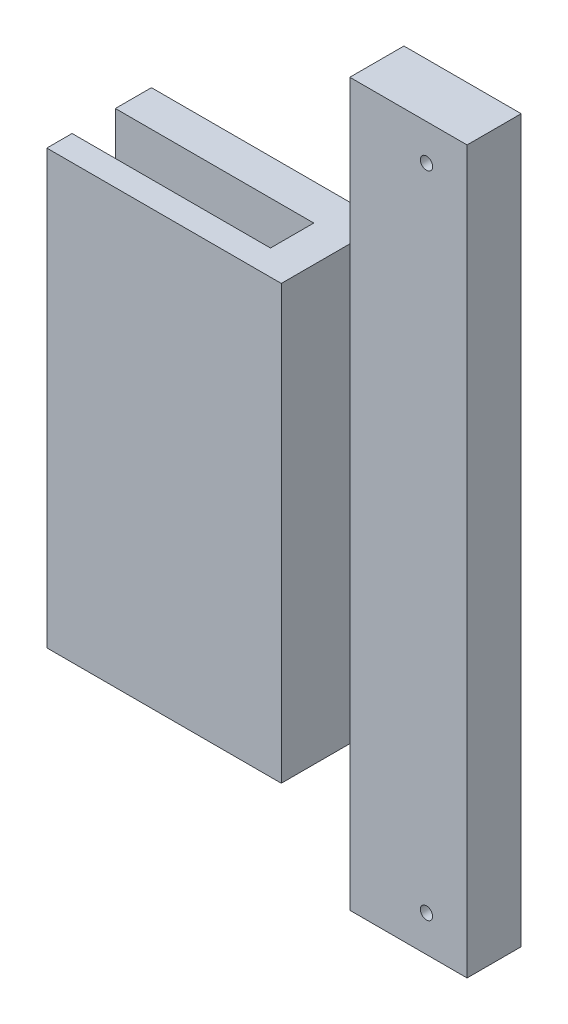
from build123d import *

# Parameters (mm, degrees)
BOSS_EXTRUDE1_DEPTH             = 15
SKETCH4_R                       = 1.7
CUT_EXTRUDE3_DEPTH              = 15
CBORE_FOR_M3_SBHCS1_D           = 3.4
CBORE_FOR_M3_SBHCS1_DEPTH       = 3.15
CBORE_FOR_M3_SBHCS1_CBORE_D     = 6.7
CBORE_FOR_M3_SBHCS1_CBORE_DEPTH = 1.65
CBORE_FOR_M3_SBHCS1_TIP         = 1.021463052
CBORE_FOR_M3_SBHCS2_D           = 3.4
CBORE_FOR_M3_SBHCS2_DEPTH       = 3.15
CBORE_FOR_M3_SBHCS2_CBORE_D     = 6.7
CBORE_FOR_M3_SBHCS2_CBORE_DEPTH = 1.65
CBORE_FOR_M3_SBHCS2_TIP         = 1.021463052
SKETCH7_W                       = 65
SKETCH7_H                       = 120
BOSS_EXTRUDE2_DEPTH             = 15
SKETCH8_W                       = 65
SKETCH8_H                       = 120
CUT_EXTRUDE4_DEPTH              = 5
SKETCH9_W                       = 10
SKETCH9_H                       = 120
BOSS_EXTRUDE3_DEPTH             = 12
SKETCH10_W                      = 65
SKETCH10_H                      = 120
BOSS_EXTRUDE4_DEPTH             = 7
SKETCH11_R                      = 11
BOSS_EXTRUDE5_DEPTH             = 12


with BuildPart() as part:
    # Sketch1 → Boss-Extrude1 (new body)
    with BuildSketch(Plane(origin=(0, 0, 0), x_dir=(0, 1, 0), z_dir=(0, 0, 1))):
        Polygon((-100, 11.25), (-100, 21.25), (100, 21.25), (100, 11.25), (100, -11.25), (-100, -11.25), align=None)
    extrude(amount=BOSS_EXTRUDE1_DEPTH)

    # Sketch4 → Cut-Extrude3 (cut)
    with BuildSketch(Plane.XY.offset(15)):
        with Locations((0, 90)):
            Circle(SKETCH4_R)
        with Locations((0, -90)):
            Circle(SKETCH4_R)
    extrude(amount=-CUT_EXTRUDE3_DEPTH, mode=Mode.SUBTRACT)

    # CBORE for M3 SBHCS1
    with Locations(Plane(origin=(0, 90, 0), x_dir=(-1, 0, 0), z_dir=(0, 0, -1))):
        with Locations((0, 0)):
            CounterBoreHole(CBORE_FOR_M3_SBHCS1_D / 2, CBORE_FOR_M3_SBHCS1_CBORE_D / 2, CBORE_FOR_M3_SBHCS1_CBORE_DEPTH, depth=CBORE_FOR_M3_SBHCS1_DEPTH)
            with Locations((0, 0, -(CBORE_FOR_M3_SBHCS1_DEPTH + CBORE_FOR_M3_SBHCS1_TIP / 2))):  # 118° drill point
                Cone(0, CBORE_FOR_M3_SBHCS1_D / 2, CBORE_FOR_M3_SBHCS1_TIP, mode=Mode.SUBTRACT)

    # CBORE for M3 SBHCS2
    with Locations(Plane(origin=(0, -90, 0), x_dir=(-1, 0, 0), z_dir=(0, 0, -1))):
        with Locations((0, 0)):
            CounterBoreHole(CBORE_FOR_M3_SBHCS2_D / 2, CBORE_FOR_M3_SBHCS2_CBORE_D / 2, CBORE_FOR_M3_SBHCS2_CBORE_DEPTH, depth=CBORE_FOR_M3_SBHCS2_DEPTH)
            with Locations((0, 0, -(CBORE_FOR_M3_SBHCS2_DEPTH + CBORE_FOR_M3_SBHCS2_TIP / 2))):  # 118° drill point
                Cone(0, CBORE_FOR_M3_SBHCS2_D / 2, CBORE_FOR_M3_SBHCS2_TIP, mode=Mode.SUBTRACT)

    # Sketch7 → Boss-Extrude2 (add)
    with BuildSketch(Plane(origin=(0, 0, 0), x_dir=(1, 0, 0), z_dir=(0, 0, -1))):
        with Locations((-53.75, 0)):
            Rectangle(SKETCH7_W, SKETCH7_H)
    extrude(amount=-BOSS_EXTRUDE2_DEPTH)

    # Sketch8 → Cut-Extrude4 (cut)
    with BuildSketch(Plane(origin=(0, 0, 0), x_dir=(1, 0, 0), z_dir=(0, 0, -1))):
        with Locations((-53.75, 0)):
            Rectangle(SKETCH8_W, SKETCH8_H)
    extrude(amount=-CUT_EXTRUDE4_DEPTH, mode=Mode.SUBTRACT)

    # Sketch9 → Boss-Extrude3 (add)
    with BuildSketch(Plane.XY.offset(15)):
        with Locations((-26.25, 0)):
            Rectangle(SKETCH9_W, SKETCH9_H)
    extrude(amount=BOSS_EXTRUDE3_DEPTH)

    # Sketch10 → Boss-Extrude4 (add)
    with BuildSketch(Plane.XY.offset(27)):
        with Locations((-53.75, 0)):
            Rectangle(SKETCH10_W, SKETCH10_H)
    extrude(amount=BOSS_EXTRUDE4_DEPTH)

    # Sketch11 → Boss-Extrude5 (add)
    with BuildSketch(Plane(origin=(0, 0, 27), x_dir=(1, 0, 0), z_dir=(0, 0, -1))):
        with Locations((-62.74, 0)):
            Circle(SKETCH11_R)
    extrude(amount=BOSS_EXTRUDE5_DEPTH)


solid = part.part
